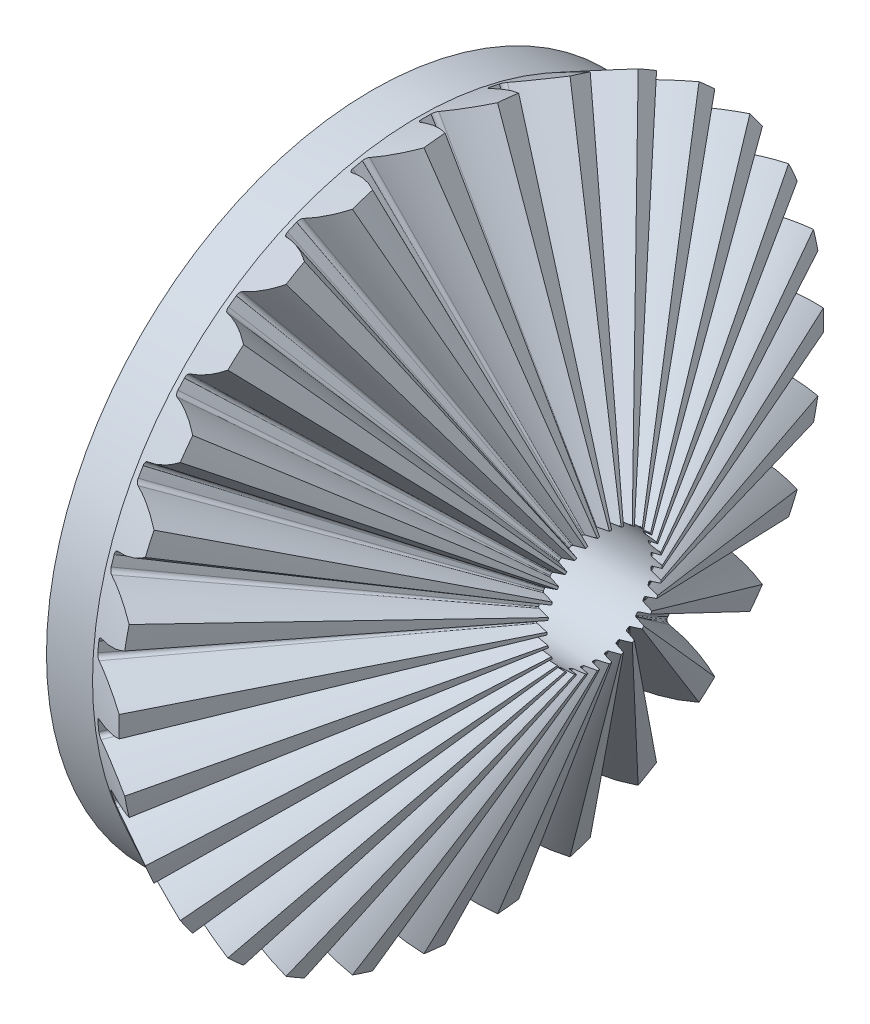
from build123d import *

# Parameters (mm, degrees)
TEETHCUTS_COUNT = 30
TEETHCUTS_ANGLE = 348
HUBSKE_R        = 3.53519772
HUB_DEPTH       = 0.5
BORSKE_R        = 0.625
BORE_DEPTH      = 4.0000508


with BuildPart() as part:
    # BasProSke → Base-Revolve (revolve)
    with BuildSketch(Plane(origin=(0, 0, 0), x_dir=(1, 0, 0), z_dir=(0, 1, 0)), mode=Mode.PRIVATE) as base_revolve_sk:
        Polygon((0, 0), (0, 3.53519772), (0.576067013, 3.823231226), (2.131750801, 0.38232312), (2.0741441, 0.35351977), (2.0741441, 0), align=None)
    revolve(base_revolve_sk.sketch.rotate(Axis((-10, 0, 0), (1, 0, 0)), 180), axis=Axis((-10, 0, 0), (1, 0, 0)))

    # ToothCut: read off the stored shape, not the designer's step
    # ToothCut: loft between two sections, ruled curve by curve
    toothcut_from = [
        Edge.make_bspline([(2.313325163, 0.004360301, -0.008138106), (2.307717507, 0.001556474, -0.015649398), (2.299002839, -0.002800861, -0.014757802), (2.294707675, -0.004948443, -0.006233354)], [0, 0, 0, 0, 1, 1, 1, 1], 3, [1, 0.712113035, 0.712113035, 1]),
        Edge.make_bspline([(2.294707675, -0.004948443, 0.006233354), (2.299002839, -0.002800861, 0.014757802), (2.307717507, 0.001556474, 0.015649398), (2.313325163, 0.004360301, 0.008138106)], [0, 0, 0, 0, 1, 1, 1, 1], 3, [1, 0.712113035, 0.712113035, 1]),
        Edge.make_bspline([(2.294707675, -0.004948443, -0.006233354), (2.294193689, -0.005205436, -0.005213264), (2.293809951, -0.005397305, -0.004123888), (2.293563742, -0.005520409, -0.002985891)], [0, 0, 0, 0, 1, 1, 1, 1], 3, [1, 0.993676093, 0.993676093, 1]),
        Edge.make_bspline([(2.293563742, -0.005520409, 0.002985891), (2.293809951, -0.005397305, 0.004123888), (2.294193689, -0.005205436, 0.005213264), (2.294707675, -0.004948443, 0.006233354)], [0, 0, 0, 0, 1, 1, 1, 1], 3, [1, 0.993676093, 0.993676093, 1]),
        Edge.make_bspline([(2.293563742, -0.005520409, -0.002985891), (2.293137172, -0.005733694, -0.001014251), (2.293137172, -0.005733694, 0.001014251), (2.293563742, -0.005520409, 0.002985891)], [0, 0, 0, 0, 1, 1, 1, 1], 3, [1, 0.98131259, 0.98131259, 1]),
        Edge.make_line((2.313325163, 0.004360301, 0.008138106), (2.313325163, 0.004360301, -0.008138106)),
    ]
    toothcut_to = [
        Edge.make_bspline([(0.633952599, 3.852174019, -0.328718049), (0.478416133, 3.774405786, -0.213535715), (0.305020394, 3.687707917, -0.136569116), (0.121174993, 3.595785217, -0.101107219)], [0, 0, 0, 0, 1, 1, 1, 1], 3, [1, 0.985755874, 0.985755874, 1]),
        Edge.make_bspline([(0.121174993, 3.595785217, 0.101107219), (0.305020394, 3.687707917, 0.136569116), (0.478416133, 3.774405786, 0.213535715), (0.633952599, 3.852174019, 0.328718049)], [0, 0, 0, 0, 1, 1, 1, 1], 3, [1, 0.985755874, 0.985755874, 1]),
        Edge.make_bspline([(0.121174993, 3.595785217, -0.101107219), (0.099338533, 3.584866987, -0.09689519), (0.085197693, 3.577796567, -0.077820972), (0.085546955, 3.577971198, -0.053049467)], [0, 0, 0, 0, 1, 1, 1, 1], 3, [1, 0.8398379, 0.8398379, 1]),
        Edge.make_bspline([(0.085546955, 3.577971198, 0.053049467), (0.085197693, 3.577796567, 0.077820972), (0.099338533, 3.584866987, 0.09689519), (0.121174993, 3.595785217, 0.101107219)], [0, 0, 0, 0, 1, 1, 1, 1], 3, [1, 0.8398379, 0.8398379, 1]),
        Edge.make_bspline([(0.085546955, 3.577971198, -0.053049467), (0.086045575, 3.578220508, -0.01768462), (0.086045575, 3.578220508, 0.01768462), (0.085546955, 3.577971198, 0.053049467)], [0, 0, 0, 0, 1, 1, 1, 1], 3, [1, 0.999917186, 0.999917186, 1]),
        Edge.make_line((0.633952599, 3.852174019, 0.328718049), (0.633952599, 3.852174019, -0.328718049)),
    ]
    toothcut = Solid(Shell([*[Face.make_surface_from_curves(toothcut_from[k], toothcut_to[k]) for k in range(6)], Face(Wire(toothcut_from)), Face(Wire(toothcut_to))]))
    add(toothcut, mode=Mode.SUBTRACT)

    # TeethCuts: ToothCut ×30 about axis
    teethcuts_axis = Axis((-10, 0, 0), (1, 0, 0))
    for i in range(1, TEETHCUTS_COUNT):
        add(toothcut.rotate(teethcuts_axis, i * TEETHCUTS_ANGLE / (TEETHCUTS_COUNT - 1)), mode=Mode.SUBTRACT)

    # HubSke → Hub (add)
    with BuildSketch(Plane.ZY):
        Circle(HUBSKE_R)
    extrude(amount=HUB_DEPTH)

    # BorSke → Bore (cut, symmetric)
    with BuildSketch(Plane(origin=(0, 0, 0), x_dir=(0, 0, -1), z_dir=(1, 0, 0))):
        with Locations(Location((0, 0, 0), (0, 0, 180))):
            Circle(BORSKE_R)
    extrude(amount=BORE_DEPTH, both=True, mode=Mode.SUBTRACT)


solid = part.part
